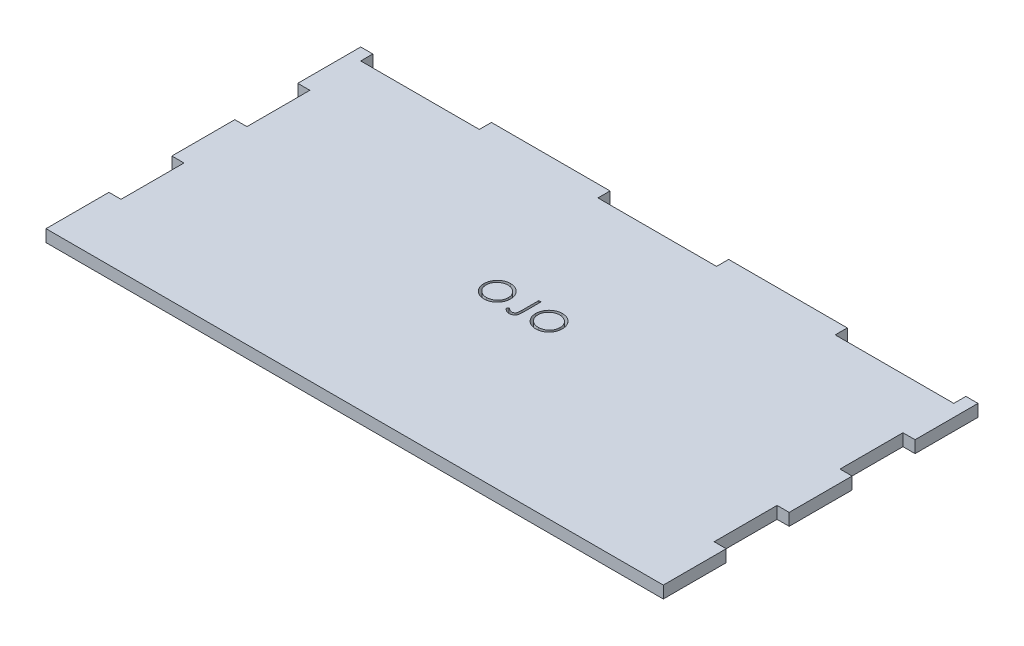
from build123d import *

# Parameters (mm, degrees)
BOSS_EXTRUDE1_DEPTH = 3
CUT_EXTRUDE1_DEPTH  = 88.322677467


with BuildPart() as part:
    # Sketch1 → Boss-Extrude1 (new body)
    with BuildSketch(Plane(origin=(0, 0, 0), x_dir=(1, 0, 0), z_dir=(0, 1, 0))):
        Polygon((-73.5, 33), (-44.1, 33), (-44.1, 36), (-14.7, 36), (-14.7, 33), (14.7, 33), (14.7, 36), (44.1, 36), (44.1, 33), (73.5, 33), (73.5, 36), (76.5, 36), (76.5, 20.4), (73.5, 20.4), (73.5, 4.8), (76.5, 4.8), (76.5, -10.8), (73.5, -10.8), (73.5, -26.4), (76.5, -26.4), (76.5, -42), (-76.5, -42), (-76.5, -26.4), (-73.5, -26.4), (-73.5, -10.8), (-76.5, -10.8), (-76.5, 4.8), (-73.5, 4.8), (-73.5, 20.4), (-76.5, 20.4), (-76.5, 36), (-73.5, 36), align=None)
    extrude(amount=BOSS_EXTRUDE1_DEPTH)

    # Sketch2 → Cut-Extrude1 (cut, through all)
    # profile 1 of 3: a face of its own
    with BuildSketch(Plane(origin=(0, 3, 0), x_dir=(1, 0, 0), z_dir=(0, 1, 0))):
        with BuildLine():
            add(Edge.make_bspline(
                [(-7.176098448, 3.786895233), (-7.059666273, 3.783946203), (-6.830983876, 3.778154066), (-6.494891086, 3.733816377), (-6.174032839, 3.657111202), (-5.865795404, 3.554952983), (-5.573865709, 3.418675415), (-5.296046411, 3.253956804), (-5.032998529, 3.059071461), (-4.788267543, 2.835525884), (-4.564312845, 2.592300292), (-4.367003163, 2.33273589), (-4.201642916, 2.058402096), (-4.065847904, 1.77012329), (-3.959313915, 1.468551429), (-3.885800067, 1.152078771), (-3.838841101, 0.822755822), (-3.833351188, 0.598136548), (-3.830566221, 0.48418985)],
                knots=[0, 0, 0, 0, 1.065120563, 2.091984664, 3.0946048, 4.079830382, 5.057816894, 6.036188127, 7.030412546, 8.04752943, 9.064399622, 10.05169764, 11.02544977, 11.989514704, 12.962713494, 13.945757189, 14.957906945, 16, 16, 16, 16], degree=3))
            add(Edge.make_bspline(
                [(-3.830566221, 0.48418985), (-3.83335078, 0.371082511), (-3.838839469, 0.148134843), (-3.88585346, -0.179098255), (-3.95958641, -0.493660611), (-4.064858592, -0.795027096), (-4.200006285, -1.083515622), (-4.366467608, -1.3583671), (-4.562547223, -1.619671636), (-4.785693287, -1.86456662), (-5.028950478, -2.089133086), (-5.289866539, -2.284813261), (-5.562573573, -2.453195032), (-5.850580877, -2.587548993), (-6.150068842, -2.694933318), (-6.463717871, -2.768148192), (-6.790058272, -2.815374655), (-7.012600964, -2.820797624), (-7.125713926, -2.823553986)],
                knots=[0, 0, 0, 0, 1.043624062, 2.057103931, 3.04512605, 4.022047818, 4.998200453, 5.980619268, 6.982898556, 8.009068085, 9.034988726, 10.034168286, 11.015286542, 11.987931943, 12.962482838, 13.94673481, 14.956375938, 16, 16, 16, 16], degree=3))
            add(Edge.make_bspline(
                [(-7.125713926, -2.823553986), (-7.239660033, -2.820770407), (-7.464278142, -2.815283232), (-7.794014921, -2.768246556), (-8.110709889, -2.694692716), (-8.413457393, -2.58957653), (-8.70242626, -2.453725027), (-8.978181643, -2.288073583), (-9.239616698, -2.091516206), (-9.484563928, -1.868442501), (-9.708684355, -1.625597605), (-9.904077978, -1.365393006), (-10.069766673, -1.092933653), (-10.205162031, -0.807463433), (-10.312353294, -0.510362378), (-10.385482271, -0.199648664), (-10.432796602, 0.122906282), (-10.43824891, 0.342523971), (-10.44101544, 0.453959137)],
                knots=[0, 0, 0, 0, 1.053102029, 2.075944431, 3.073151272, 4.055350789, 5.033113405, 6.020478099, 7.024410459, 8.052272461, 9.079885166, 10.07527673, 11.055994387, 12.023226415, 12.992069828, 13.970394897, 14.97016774, 16, 16, 16, 16], degree=3))
            add(Edge.make_bspline(
                [(-10.44101544, 0.453959137), (-10.440054931, 0.528755061), (-10.43814603, 0.677403326), (-10.415164883, 0.898141538), (-10.381817523, 1.115329835), (-10.334025376, 1.328350615), (-10.271519778, 1.536682419), (-10.197767016, 1.741762036), (-10.10768737, 1.941511165), (-10.005856727, 2.136876072), (-9.892202582, 2.324811296), (-9.766666041, 2.502455199), (-9.633656461, 2.671298458), (-9.487840899, 2.826965699), (-9.334025127, 2.973985434), (-9.169713924, 3.110098313), (-8.995909895, 3.236531704), (-8.811865186, 3.350470664), (-8.622114765, 3.453520255), (-8.426510221, 3.541950661), (-8.227708157, 3.617848587), (-8.024777442, 3.67936456), (-7.818256961, 3.727929453), (-7.607695975, 3.760999517), (-7.393262233, 3.784039278), (-7.248797824, 3.785939152), (-7.176098448, 3.786895233)],
                knots=[0, 0, 0, 0, 1.037015668, 2.060948919, 3.074880161, 4.083647147, 5.086022904, 6.090072063, 7.104153813, 8.122640571, 9.144368836, 10.147691507, 11.138137339, 12.123020368, 13.103399296, 14.087645067, 15.080126199, 16.082011238, 17.087798457, 18.072939717, 19.057185487, 20.037253025, 21.01195951, 21.997135196, 22.992090687, 24, 24, 24, 24], degree=3))
        make_face()
        with BuildLine():
            add(Edge.make_bspline(
                [(-7.148386961, 3.141973358), (-7.208059311, 3.141245945), (-7.32683354, 3.139798073), (-7.503408401, 3.120726218), (-7.677661013, 3.093544342), (-7.849627364, 3.054771671), (-8.018587926, 3.001945288), (-8.186117614, 2.941147793), (-8.350688736, 2.867091297), (-8.511757996, 2.783420263), (-8.667906845, 2.690809117), (-8.815248247, 2.588455459), (-8.954163641, 2.478759609), (-9.084312902, 2.361465565), (-9.205313868, 2.235976), (-9.319548113, 2.104193354), (-9.422436815, 1.962350907), (-9.516730727, 1.814295001), (-9.60111165, 1.660218481), (-9.676145953, 1.501743458), (-9.737523921, 1.337577223), (-9.787580576, 1.16950081), (-9.829080959, 0.997780414), (-9.8553718, 0.821113367), (-9.874653215, 0.640387399), (-9.876018329, 0.51825337), (-9.876708799, 0.456478363)],
                knots=[0, 0, 0, 0, 1.008559885, 2.007477868, 2.99961109, 3.989939068, 4.984837346, 5.991145699, 7.001802488, 8.033829008, 9.059044045, 10.069351652, 11.065060232, 12.050310815, 13.029377138, 14.011219647, 14.996725999, 15.989392538, 16.977580475, 17.965360261, 18.951710183, 19.937753436, 20.929683414, 21.935841486, 22.955955122, 24, 24, 24, 24], degree=3))
            add(Edge.make_bspline(
                [(-9.876708799, 0.456478363), (-9.874418423, 0.365639891), (-9.869912544, 0.186932515), (-9.830464274, -0.07494988), (-9.769700795, -0.326628023), (-9.680128642, -0.566724812), (-9.568111518, -0.797304054), (-9.429727465, -1.016320263), (-9.265774305, -1.223832634), (-9.079535722, -1.418392457), (-8.875943765, -1.595975674), (-8.659757823, -1.751852045), (-8.433293935, -1.883738556), (-8.195961538, -1.99118244), (-7.949027677, -2.07632133), (-7.690901175, -2.134671402), (-7.423301533, -2.173073863), (-7.240894799, -2.176761779), (-7.148386961, -2.178632111)],
                knots=[0, 0, 0, 0, 1.032063989, 2.030389145, 3.003944642, 3.970395727, 4.937377036, 5.913328081, 6.909231446, 7.93887556, 8.970685674, 9.976071282, 10.964166581, 11.944589148, 12.933237628, 13.927779006, 14.949070134, 16, 16, 16, 16], degree=3))
            add(Edge.make_bspline(
                [(-7.148386961, -2.178632111), (-7.086208635, -2.177777835), (-6.96289034, -2.176083549), (-6.779468783, -2.159018529), (-6.599351673, -2.131653439), (-6.422791646, -2.092253523), (-6.249989084, -2.042942748), (-6.080222737, -1.984360745), (-5.915300859, -1.911274193), (-5.753142915, -1.830522138), (-5.597926185, -1.738465706), (-5.449753276, -1.639585924), (-5.312358972, -1.530051646), (-5.182307077, -1.414500317), (-5.06080933, -1.290602069), (-4.948687341, -1.158517985), (-4.846318654, -1.017414347), (-4.752060548, -0.869583014), (-4.6679753, -0.715084891), (-4.594712872, -0.556035298), (-4.532558595, -0.392825874), (-4.482383135, -0.225221214), (-4.443064413, -0.053539644), (-4.41597231, 0.122448713), (-4.397021322, 0.30239179), (-4.395592911, 0.42409824), (-4.394872862, 0.485449463)],
                knots=[0, 0, 0, 0, 1.047197238, 2.076906641, 3.100256066, 4.114471768, 5.12198147, 6.126382909, 7.136867548, 8.15857795, 9.17633901, 10.174870724, 11.156907918, 12.133735059, 13.104061851, 14.077631395, 15.04955518, 16.038496417, 17.029181396, 18.010275684, 18.986308667, 19.968651475, 20.955262928, 21.950658345, 22.966943676, 24, 24, 24, 24], degree=3))
            add(Edge.make_bspline(
                [(-4.394872862, 0.485449463), (-4.395593488, 0.546380975), (-4.397022984, 0.667249854), (-4.415963258, 0.845937985), (-4.443093035, 1.020660001), (-4.482191222, 1.190729968), (-4.532585233, 1.356191238), (-4.594723727, 1.51688841), (-4.667997294, 1.673420144), (-4.752091456, 1.825399558), (-4.846619365, 1.971235501), (-4.949911687, 2.110653518), (-5.063751849, 2.241035389), (-5.184887293, 2.365599887), (-5.31634377, 2.481690325), (-5.457525804, 2.589345213), (-5.606719425, 2.691162608), (-5.764686689, 2.783013161), (-5.92771438, 2.867836744), (-6.094999945, 2.940509725), (-6.264648251, 3.002261578), (-6.436227891, 3.054931502), (-6.611183041, 3.093392485), (-6.788331533, 3.120750714), (-6.967428276, 3.139791435), (-7.087875985, 3.141243742), (-7.148386961, 3.141973358)],
                knots=[0, 0, 0, 0, 1.02996197, 2.043119294, 3.035359645, 4.018872909, 4.991431989, 5.957985074, 6.929999688, 7.912076566, 8.892894881, 9.867085534, 10.843653904, 11.817741046, 12.803660682, 13.806313499, 14.818574707, 15.856120519, 16.894564902, 17.924820532, 18.937903209, 19.946497019, 20.957711757, 21.963978472, 22.977135795, 24, 24, 24, 24], degree=3))
        make_face(mode=Mode.SUBTRACT)
    # profile 2 of 3: a face of its own
    with BuildSketch(Plane(origin=(0, 3, 0), x_dir=(1, 0, 0), z_dir=(0, 1, 0))):
        with BuildLine():
            Line((0.006718935, 3.625664764), (0.571025576, 3.625664764))
            Line((0.571025576, 3.625664764), (0.571025576, -0.620490784))
            add(Edge.make_bspline(
                [(0.571025576, -0.620490784), (0.5704616, -0.699010099), (0.569378697, -0.849776765), (0.563424132, -1.066934948), (0.552404922, -1.2652234), (0.536352564, -1.445093006), (0.514937054, -1.605980268), (0.490430018, -1.74912833), (0.460763651, -1.873342476), (0.416089351, -2.012819678), (0.342836177, -2.16578632), (0.232586115, -2.330990008), (0.095628706, -2.475494107), (-0.063010112, -2.600989282), (-0.244716847, -2.700981287), (-0.445749616, -2.772763486), (-0.664870894, -2.816547389), (-0.816859138, -2.821171584), (-0.895163999, -2.823553986)],
                knots=[0, 0, 0, 0, 1.237770943, 2.376671248, 3.424123796, 4.367912054, 5.222547132, 5.982086412, 6.656319012, 7.234008312, 8.288027371, 9.317870876, 10.352700517, 11.413286737, 12.494591526, 13.606319346, 14.766767577, 16, 16, 16, 16], degree=3))
            add(Edge.make_bspline(
                [(-0.895163999, -2.823553986), (-0.956172502, -2.821612598), (-1.07892565, -2.817706397), (-1.261619931, -2.785868133), (-1.443795484, -2.736793001), (-1.626419232, -2.664925615), (-1.813099259, -2.567182254), (-2.006363896, -2.439293885), (-2.208699126, -2.281498568), (-2.34197445, -2.161060694), (-2.411738096, -2.098016876)],
                knots=[0, 0, 0, 0, 0.848567217, 1.707373443, 2.573483905, 3.470863513, 4.432650262, 5.500696352, 6.691726801, 8, 8, 8, 8], degree=3))
            Line((-2.411738096, -2.098016876), (-2.079200254, -1.61432547))
            add(Edge.make_bspline(
                [(-2.079200254, -1.61432547), (-2.002481984, -1.667229722), (-1.857627887, -1.767119848), (-1.644726591, -1.895622256), (-1.456092057, -2.005797091), (-1.332698466, -2.061943938), (-1.275567136, -2.087939972)],
                knots=[0, 0, 0, 0, 1.196737151, 2.259595785, 3.194191475, 4, 4, 4, 4], degree=3))
            add(Edge.make_bspline(
                [(-1.275567136, -2.087939972), (-1.240921558, -2.101521052), (-1.172973863, -2.128156574), (-1.069087171, -2.157882406), (-0.965793423, -2.174127711), (-0.897312391, -2.177148341), (-0.863673673, -2.178632111)],
                knots=[0, 0, 0, 0, 1.051806502, 2.062826769, 3.048436908, 4, 4, 4, 4], degree=3))
            add(Edge.make_bspline(
                [(-0.863673673, -2.178632111), (-0.820227648, -2.176794698), (-0.734350874, -2.17316281), (-0.609554079, -2.141095372), (-0.490157702, -2.092148947), (-0.380441904, -2.020481522), (-0.279321374, -1.935267745), (-0.195883676, -1.832223771), (-0.126325511, -1.718023153), (-0.084466025, -1.60992104), (-0.057796382, -1.511331438), (-0.040869788, -1.420724875), (-0.026068473, -1.314796565), (-0.013166326, -1.193420066), (-0.005612709, -1.056352374), (0.002862193, -0.903995957), (0.00592581, -0.735966696), (0.006446493, -0.618810781), (0.006718935, -0.557510132)],
                knots=[0, 0, 0, 0, 0.997221856, 1.971139923, 2.944579524, 3.951425367, 4.971190333, 5.972282193, 6.985401279, 8.033996657, 8.624075553, 9.332086008, 10.151144245, 11.082816738, 12.137127781, 13.306538797, 14.590673636, 16, 16, 16, 16], degree=3))
            Line((0.006718935, -0.557510132), (0.006718935, 3.625664764))
        make_face()
    # profile 3 of 3: a face of its own
    with BuildSketch(Plane(origin=(0, 3, 0), x_dir=(1, 0, 0), z_dir=(0, 1, 0))):
        with BuildLine():
            add(Edge.make_bspline(
                [(5.657846865, 3.786895233), (5.774279039, 3.783946203), (6.002961436, 3.778154066), (6.339054226, 3.733816377), (6.659912474, 3.657111202), (6.968149908, 3.554952983), (7.260079603, 3.418675415), (7.537898902, 3.253956804), (7.800946784, 3.059071461), (8.04567777, 2.835525884), (8.269632467, 2.592300292), (8.466942149, 2.33273589), (8.632302396, 2.058402096), (8.768097409, 1.77012329), (8.874631398, 1.468551429), (8.948145246, 1.152078771), (8.995104212, 0.822755822), (9.000594124, 0.598136548), (9.003379092, 0.48418985)],
                knots=[0, 0, 0, 0, 1.065120563, 2.091984664, 3.0946048, 4.079830382, 5.057816894, 6.036188127, 7.030412546, 8.04752943, 9.064399622, 10.05169764, 11.02544977, 11.989514704, 12.962713494, 13.945757189, 14.957906945, 16, 16, 16, 16], degree=3))
            add(Edge.make_bspline(
                [(9.003379092, 0.48418985), (9.000594532, 0.371082511), (8.995105843, 0.148134843), (8.948091853, -0.179098255), (8.874358902, -0.493660611), (8.769086721, -0.795027096), (8.633939027, -1.083515622), (8.467477704, -1.3583671), (8.271398089, -1.619671636), (8.048252025, -1.86456662), (7.804994835, -2.089133086), (7.544078773, -2.284813261), (7.27137174, -2.453195032), (6.983364435, -2.587548993), (6.68387647, -2.694933318), (6.370227441, -2.768148192), (6.04388704, -2.815374655), (5.821344349, -2.820797624), (5.708231386, -2.823553986)],
                knots=[0, 0, 0, 0, 1.043624062, 2.057103931, 3.04512605, 4.022047818, 4.998200453, 5.980619268, 6.982898556, 8.009068085, 9.034988726, 10.034168286, 11.015286542, 11.987931943, 12.962482838, 13.94673481, 14.956375938, 16, 16, 16, 16], degree=3))
            add(Edge.make_bspline(
                [(5.708231386, -2.823553986), (5.594285279, -2.820770407), (5.369667171, -2.815283232), (5.039930391, -2.768246556), (4.723235424, -2.694692716), (4.420487919, -2.58957653), (4.131519053, -2.453725027), (3.855763669, -2.288073583), (3.594328614, -2.091516206), (3.349381385, -1.868442501), (3.125260957, -1.625597605), (2.929867334, -1.365393006), (2.76417864, -1.092933653), (2.628783282, -0.807463433), (2.521592019, -0.510362378), (2.448463042, -0.199648664), (2.401148711, 0.122906282), (2.395696403, 0.342523971), (2.392929873, 0.453959137)],
                knots=[0, 0, 0, 0, 1.053102029, 2.075944431, 3.073151272, 4.055350789, 5.033113405, 6.020478099, 7.024410459, 8.052272461, 9.079885166, 10.07527673, 11.055994387, 12.023226415, 12.992069828, 13.970394897, 14.97016774, 16, 16, 16, 16], degree=3))
            add(Edge.make_bspline(
                [(2.392929873, 0.453959137), (2.393890382, 0.528755061), (2.395799283, 0.677403326), (2.418780429, 0.898141538), (2.452127789, 1.115329835), (2.499919936, 1.328350615), (2.562425534, 1.536682419), (2.636178296, 1.741762036), (2.726257942, 1.941511165), (2.828088585, 2.136876072), (2.94174273, 2.324811296), (3.067279271, 2.502455199), (3.200288851, 2.671298458), (3.346104413, 2.826965699), (3.499920186, 2.973985434), (3.664231389, 3.110098313), (3.838035417, 3.236531704), (4.022080127, 3.350470664), (4.211830548, 3.453520255), (4.407435092, 3.541950661), (4.606237156, 3.617848587), (4.809167871, 3.67936456), (5.015688352, 3.727929453), (5.226249337, 3.760999517), (5.440683079, 3.784039278), (5.585147488, 3.785939152), (5.657846865, 3.786895233)],
                knots=[0, 0, 0, 0, 1.037015668, 2.060948919, 3.074880161, 4.083647147, 5.086022904, 6.090072063, 7.104153813, 8.122640571, 9.144368836, 10.147691507, 11.138137339, 12.123020368, 13.103399296, 14.087645067, 15.080126199, 16.082011238, 17.087798457, 18.072939717, 19.057185487, 20.037253025, 21.01195951, 21.997135196, 22.992090687, 24, 24, 24, 24], degree=3))
        make_face()
        with BuildLine():
            add(Edge.make_bspline(
                [(5.685558352, 3.141973358), (5.625886001, 3.141245945), (5.507111772, 3.139798073), (5.330536912, 3.120726218), (5.156284299, 3.093544342), (4.984317949, 3.054771671), (4.815357387, 3.001945288), (4.647827699, 2.941147793), (4.483256576, 2.867091297), (4.322187317, 2.783420263), (4.166038467, 2.690809117), (4.018697066, 2.588455459), (3.879781671, 2.478759609), (3.749632411, 2.361465565), (3.628631445, 2.235976), (3.5143972, 2.104193354), (3.411508497, 1.962350907), (3.317214585, 1.814295001), (3.232833663, 1.660218481), (3.15779936, 1.501743458), (3.096421392, 1.337577223), (3.046364736, 1.16950081), (3.004864353, 0.997780414), (2.978573512, 0.821113367), (2.959292098, 0.640387399), (2.957926984, 0.51825337), (2.957236513, 0.456478363)],
                knots=[0, 0, 0, 0, 1.008559885, 2.007477868, 2.99961109, 3.989939068, 4.984837346, 5.991145699, 7.001802488, 8.033829008, 9.059044045, 10.069351652, 11.065060232, 12.050310815, 13.029377138, 14.011219647, 14.996725999, 15.989392538, 16.977580475, 17.965360261, 18.951710183, 19.937753436, 20.929683414, 21.935841486, 22.955955122, 24, 24, 24, 24], degree=3))
            add(Edge.make_bspline(
                [(2.957236513, 0.456478363), (2.95952689, 0.365639891), (2.964032768, 0.186932515), (3.003481038, -0.07494988), (3.064244518, -0.326628023), (3.153816671, -0.566724812), (3.265833795, -0.797304054), (3.404217847, -1.016320263), (3.568171008, -1.223832634), (3.754409591, -1.418392457), (3.958001548, -1.595975674), (4.17418749, -1.751852045), (4.400651377, -1.883738556), (4.637983775, -1.99118244), (4.884917636, -2.07632133), (5.143044138, -2.134671402), (5.410643779, -2.173073863), (5.593050513, -2.176761779), (5.685558352, -2.178632111)],
                knots=[0, 0, 0, 0, 1.032063989, 2.030389145, 3.003944642, 3.970395727, 4.937377036, 5.913328081, 6.909231446, 7.93887556, 8.970685674, 9.976071282, 10.964166581, 11.944589148, 12.933237628, 13.927779006, 14.949070134, 16, 16, 16, 16], degree=3))
            add(Edge.make_bspline(
                [(5.685558352, -2.178632111), (5.747736678, -2.177777835), (5.871054973, -2.176083549), (6.054476529, -2.159018529), (6.234593639, -2.131653439), (6.411153667, -2.092253523), (6.583956229, -2.042942748), (6.753722576, -1.984360745), (6.918644454, -1.911274193), (7.080802397, -1.830522138), (7.236019127, -1.738465706), (7.384192036, -1.639585924), (7.52158634, -1.530051646), (7.651638236, -1.414500317), (7.773135983, -1.290602069), (7.885257972, -1.158517985), (7.987626659, -1.017414347), (8.081884765, -0.869583014), (8.165970012, -0.715084891), (8.23923244, -0.556035298), (8.301386718, -0.392825874), (8.351562178, -0.225221214), (8.3908809, -0.053539644), (8.417973003, 0.122448713), (8.436923991, 0.30239179), (8.438352401, 0.42409824), (8.439072451, 0.485449463)],
                knots=[0, 0, 0, 0, 1.047197238, 2.076906641, 3.100256066, 4.114471768, 5.12198147, 6.126382909, 7.136867548, 8.15857795, 9.17633901, 10.174870724, 11.156907918, 12.133735059, 13.104061851, 14.077631395, 15.04955518, 16.038496417, 17.029181396, 18.010275684, 18.986308667, 19.968651475, 20.955262928, 21.950658345, 22.966943676, 24, 24, 24, 24], degree=3))
            add(Edge.make_bspline(
                [(8.439072451, 0.485449463), (8.438351824, 0.546380975), (8.436922328, 0.667249854), (8.417982055, 0.845937985), (8.390852277, 1.020660001), (8.351754091, 1.190729968), (8.30136008, 1.356191238), (8.239221586, 1.51688841), (8.165948019, 1.673420144), (8.081853857, 1.825399558), (7.987325948, 1.971235501), (7.884033626, 2.110653518), (7.770193464, 2.241035389), (7.64905802, 2.365599887), (7.517601543, 2.481690325), (7.376419508, 2.589345213), (7.227225888, 2.691162608), (7.069258623, 2.783013161), (6.906230932, 2.867836744), (6.738945368, 2.940509725), (6.569297061, 3.002261578), (6.397717422, 3.054931502), (6.222762271, 3.093392485), (6.04561378, 3.120750714), (5.866517036, 3.139791435), (5.746069328, 3.141243742), (5.685558352, 3.141973358)],
                knots=[0, 0, 0, 0, 1.02996197, 2.043119294, 3.035359645, 4.018872909, 4.991431989, 5.957985074, 6.929999688, 7.912076566, 8.892894881, 9.867085534, 10.843653904, 11.817741046, 12.803660682, 13.806313499, 14.818574707, 15.856120519, 16.894564902, 17.924820532, 18.937903209, 19.946497019, 20.957711757, 21.963978472, 22.977135795, 24, 24, 24, 24], degree=3))
        make_face(mode=Mode.SUBTRACT)
    extrude(amount=-CUT_EXTRUDE1_DEPTH, mode=Mode.SUBTRACT)


with BuildPart() as cut_extrude1_piece_1:
    # of the separate pieces the step leaves, piece 1, a body of its own (cut_extrude1_pieces)
    add(part.part.solids().sort_by_distance((-73.5, 0, -33))[0])


with BuildPart() as cut_extrude1_piece_2:
    # of the separate pieces the step leaves, piece 2, a body of its own (cut_extrude1_pieces)
    add(part.part.solids().sort_by_distance((-7.148386961, 0, 2.178632111))[0])


with BuildPart() as cut_extrude1_piece_3:
    # of the separate pieces the step leaves, piece 3, a body of its own (cut_extrude1_pieces)
    add(part.part.solids().sort_by_distance((5.685558352, 0, 2.178632111))[0])


solid = Compound([cut_extrude1_piece_1.part, cut_extrude1_piece_2.part, cut_extrude1_piece_3.part])
